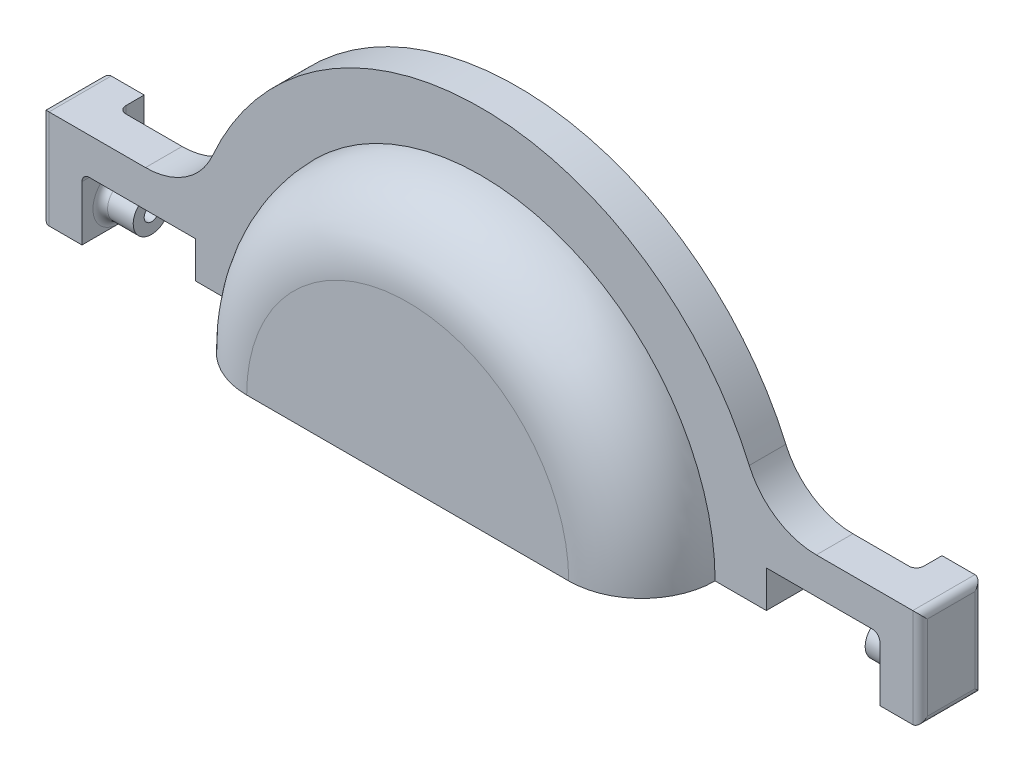
from build123d import *

# Parameters (mm, degrees)
SKETCH1_R              = 32
BOSS_EXTRUDE1_DEPTH    = 15
FILLET1_R              = 10
SHELL1_T               = -2
SKETCH2_W              = 15
SKETCH2_H              = 10
BOSS_EXTRUDE2_DEPTH    = 5
SKETCH3_R              = 29
CUT_EXTRUDE1_DEPTH     = 5
SPLIT1_SURFACE_1_BACK  = 146
SPLIT1_SURFACE_1_DEPTH = 292
SPLIT1_SURFACE_2_BACK  = 146
SPLIT1_SURFACE_2_DEPTH = 292
SKETCH6_R              = 2.5
SKETCH6_R_2            = 1
BOSS_EXTRUDE3_DEPTH    = 5
BOSS_EXTRUDE4_START    = 5
SKETCH5_R              = 2.5
SKETCH5_R_2            = 1
BOSS_EXTRUDE4_DEPTH    = 5
SKETCH7_W              = 8.5
SKETCH7_H              = 13.5
BOSS_EXTRUDE5_DEPTH    = 5.5
SKETCH8_W              = 8.5
SKETCH8_H              = 13.5
BOSS_EXTRUDE6_DEPTH    = 5.5
FILLET3_R              = 1
FILLET4_R              = 10
SKETCH9_W              = 1
SKETCH9_H              = 5.049910015
SKETCH9_H_2            = 5
CUT_EXTRUDE2_DEPTH     = 10


with BuildPart() as part:
    # Sketch1 → Boss-Extrude1 (new body)
    with BuildSketch(Plane.XY):
        Circle(SKETCH1_R)
    extrude(amount=BOSS_EXTRUDE1_DEPTH)

    # Fillet1
    fillet1_edges = [part.edges().sort_by_distance(p)[0] for p in [
        (-32, 0, 15),
    ]]
    fillet(fillet1_edges, radius=FILLET1_R)

    # Shell1
    shell1_openings = [part.faces().sort_by_distance(p)[0] for p in [
        (0, 0, 0),
    ]]
    offset(amount=SHELL1_T, openings=shell1_openings, kind=Kind.INTERSECTION)

    # Sketch2 → Boss-Extrude2 (add)
    with BuildSketch(Plane(origin=(0, 0, 0), x_dir=(-1, 0, 0), z_dir=(0, 0, -1))):
        with BuildLine():
            Line((-60, 10), (-38.729833462, 10))
            ThreePointArc((-38.729833462, 10), (0, 40), (38.729833462, 10))
            Line((38.729833462, 10), (60, 10))
            Line((60, 10), (60, -10))
            Line((60, -10), (38.729833462, -10))
            ThreePointArc((38.729833462, -10), (0, -40), (-38.729833462, -10))
            Line((-38.729833462, -10), (-60, -10))
            Line((-60, -10), (-60, 10))
        make_face()
        with Locations((-47.5, 0.049910015)):
            Rectangle(SKETCH2_W, SKETCH2_H, mode=Mode.SUBTRACT)
        with Locations((47.5, 0)):
            Rectangle(SKETCH2_W, SKETCH2_H, mode=Mode.SUBTRACT)
    extrude(amount=-BOSS_EXTRUDE2_DEPTH)

    # Sketch3 → Cut-Extrude1 (cut)
    with BuildSketch(Plane(origin=(0, 0, 0), x_dir=(-1, 0, 0), z_dir=(0, 0, -1))):
        Circle(SKETCH3_R)
    extrude(amount=-CUT_EXTRUDE1_DEPTH, mode=Mode.SUBTRACT)


with BuildPart() as body_2:
    # Split1: the piece behind the surface
    add(part.part)
    # Split1 surface: a surface, the sketch's curves swept straight by 292 mm
    with BuildLine(Plane(origin=(0, 0, 0), x_dir=(-1, 0, 0), z_dir=(0, 0, -1)).offset(-SPLIT1_SURFACE_1_BACK), mode=Mode.PRIVATE) as split1_surface_1_path:
        Line((-60, 0), (60, 0))
    split1_surface_1 = Shell.extrude(split1_surface_1_path.wire(), (0 * SPLIT1_SURFACE_1_DEPTH, 0 * SPLIT1_SURFACE_1_DEPTH, -1 * SPLIT1_SURFACE_1_DEPTH))
    split(bisect_by=split1_surface_1, keep=Keep.BOTTOM)


with BuildPart() as part_1:
    add(part.part)

    # Split1: split by a surface, the side it looks to stays
    # Split1 surface: a surface, the sketch's curves swept straight by 292 mm
    with BuildLine(Plane(origin=(0, 0, 0), x_dir=(-1, 0, 0), z_dir=(0, 0, -1)).offset(-SPLIT1_SURFACE_2_BACK), mode=Mode.PRIVATE) as split1_surface_2_path:
        Line((-60, 0), (60, 0))
    split1_surface_2 = Shell.extrude(split1_surface_2_path.wire(), (0 * SPLIT1_SURFACE_2_DEPTH, 0 * SPLIT1_SURFACE_2_DEPTH, -1 * SPLIT1_SURFACE_2_DEPTH))
    split(bisect_by=split1_surface_2, keep=Keep.TOP)

    # Sketch6 → Boss-Extrude3 (add)
    with BuildSketch(Plane.ZY.offset(-55)):
        Circle(SKETCH6_R)
        Circle(SKETCH6_R_2, mode=Mode.SUBTRACT)
    extrude(amount=BOSS_EXTRUDE3_DEPTH)

    # Sketch5 → Boss-Extrude4 (add)
    with BuildSketch(Plane(origin=(-55, 0, 0), x_dir=(0, 0, -1), z_dir=(1, 0, 0)).offset(BOSS_EXTRUDE4_START)):
        with Locations(Location((0, 0, 0), (0, 0, 180))):
            Circle(SKETCH5_R)
        with Locations(Location((0, 0, 0), (0, 0, 180))):
            Circle(SKETCH5_R_2, mode=Mode.SUBTRACT)
    extrude(amount=-BOSS_EXTRUDE4_DEPTH)

    # Sketch7 → Boss-Extrude5 (add)
    with BuildSketch(Plane(origin=(60, 0, 0), x_dir=(0, 0, -1), z_dir=(1, 0, 0))):
        with Locations((-0.75, 3.25)):
            Rectangle(SKETCH7_W, SKETCH7_H)
    extrude(amount=-BOSS_EXTRUDE5_DEPTH)

    # Sketch8 → Boss-Extrude6 (add)
    with BuildSketch(Plane.ZY.offset(60)):
        with Locations((0.75, 3.25)):
            Rectangle(SKETCH8_W, SKETCH8_H)
    extrude(amount=-BOSS_EXTRUDE6_DEPTH)

    # Fillet3
    fillet3_edges = [part_1.edges().sort_by_distance(p)[0] for p in [
        (60, 3.25, 5),
        (-60, 3.25, 5),
        (-60, 10, 0.75),
        (60, 10, 0.75),
        (54.5, 5.049910015, 2.5),
        (54.5, 7.524955008, 0),
        (54.5, 0, -2.5),
        (60, 3.25, -3.5),
        (60, -3.5, 0.75),
        (-54.5, 0, -2.5),
        (-54.5, 7.5, 0),
        (-54.5, 5, 2.5),
        (-60, -3.5, 0.75),
        (-60, 3.25, -3.5),
    ]]
    fillet(fillet3_edges, radius=FILLET3_R - 0.0001)  # a hair under: the kernel refuses the full size

    # Fillet4
    fillet4_edges = [part_1.edges().sort_by_distance(p)[0] for p in [
        (-38.729833462, 10, 2.5),
        (38.729833462, 10, 2.5),
    ]]
    fillet(fillet4_edges, radius=FILLET4_R)

    # Sketch9 → Cut-Extrude2 (cut)
    with BuildSketch(Plane(origin=(0, 0, 0), x_dir=(-1, 0, 0), z_dir=(0, 0, -1))):
        with Locations((-39.5, 2.524955008)):
            Rectangle(SKETCH9_W, SKETCH9_H)
        with Locations((39.5, 2.5)):
            Rectangle(SKETCH9_W, SKETCH9_H_2)
    extrude(amount=-CUT_EXTRUDE2_DEPTH, mode=Mode.SUBTRACT)


solid = part_1.part
